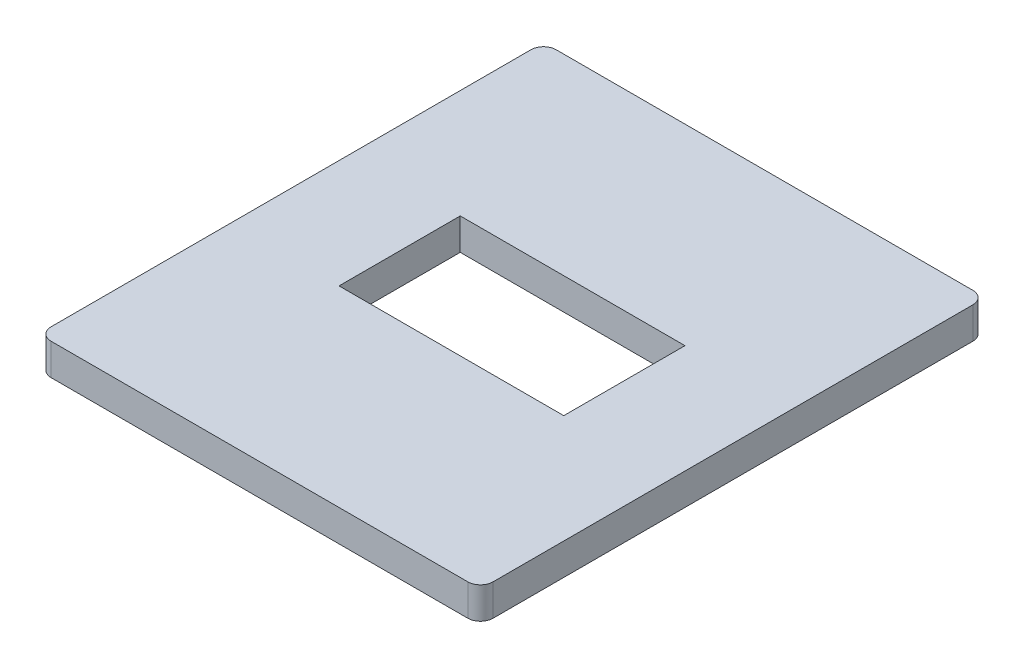
from build123d import *

# Parameters (mm, degrees)
SKETCH1_W           = 44.45
SKETCH1_H           = 50.8
SKETCH1_W_2         = 22.606
SKETCH1_H_2         = 12.192
BOSS_EXTRUDE1_DEPTH = 3.175
FILLET1_R           = 1.27


with BuildPart() as part:
    # Sketch1 → Boss-Extrude1 (new body)
    with BuildSketch(Plane(origin=(0, 0, 0), x_dir=(1, 0, 0), z_dir=(0, 1, 0))):
        with Locations((-0.329912538, 1.556243023)):
            Rectangle(SKETCH1_W, SKETCH1_H)
        with Locations((-0.329912538, 1.556243023)):
            Rectangle(SKETCH1_W_2, SKETCH1_H_2, mode=Mode.SUBTRACT)
    extrude(amount=BOSS_EXTRUDE1_DEPTH)

    # Fillet1
    fillet1_edges = [part.edges().sort_by_distance(p)[0] for p in [
        (21.895087462, 1.5875, 23.843756977),
        (21.895087462, 1.5875, -26.956243023),
        (-22.554912538, 1.5875, 23.843756977),
        (-22.554912538, 1.5875, -26.956243023),
    ]]
    fillet(fillet1_edges, radius=FILLET1_R)


solid = part.part
